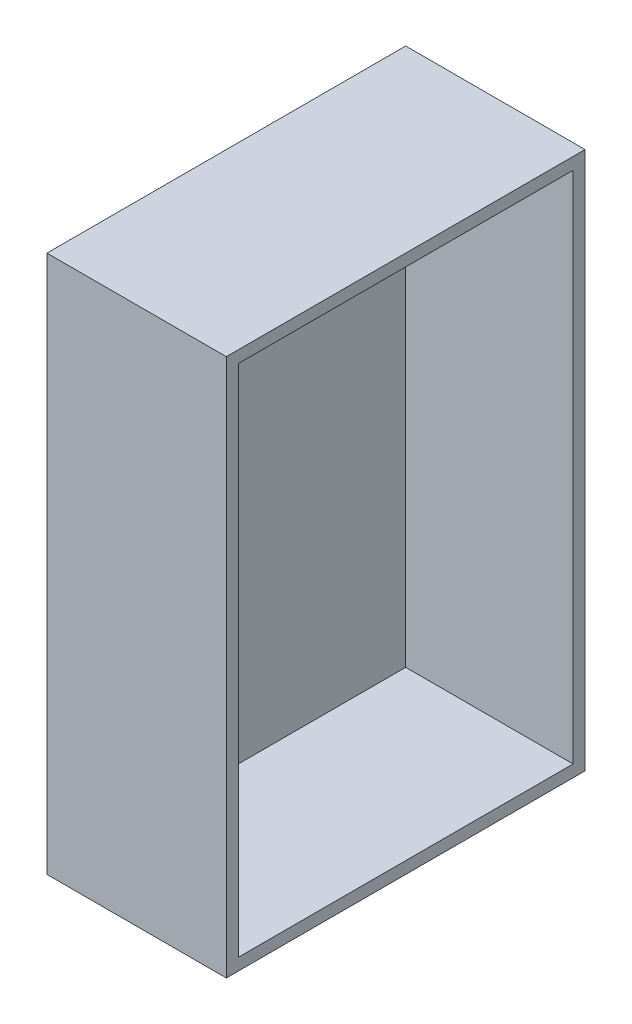
from build123d import *

# Parameters (mm, degrees)
SKETCH1_W           = 90
SKETCH1_H           = 60
BOSS_EXTRUDE1_DEPTH = 30
SHELL1_T            = -2


with BuildPart() as part:
    # Sketch1 → Boss-Extrude1 (new body)
    with BuildSketch(Plane.YZ):
        Rectangle(SKETCH1_W, SKETCH1_H)
    extrude(amount=BOSS_EXTRUDE1_DEPTH)

    # Shell1
    shell1_openings = [part.faces().sort_by_distance(p)[0] for p in [
        (30, 0, 0),
    ]]
    offset(amount=SHELL1_T, openings=shell1_openings, kind=Kind.INTERSECTION)


solid = part.part
